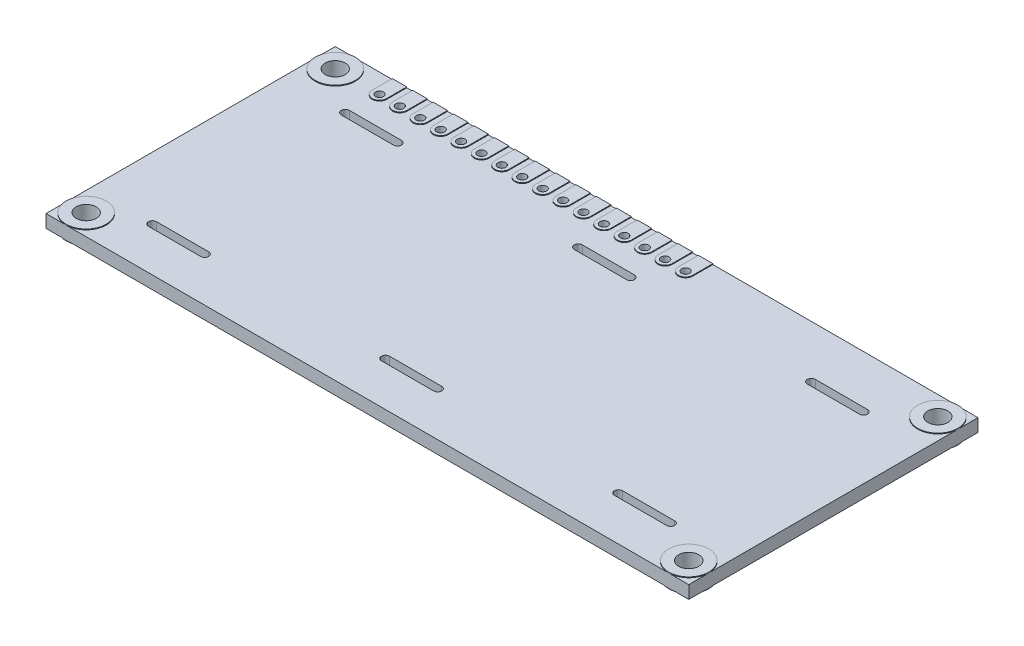
from build123d import *

# Parameters (mm, degrees)
SKETCH1_W           = 80
SKETCH1_H           = 36
SKETCH1_R           = 1.25
SKETCH1_R_2         = 0.5
BOSS_EXTRUDE1_DEPTH = 1.6
BOSS_EXTRUDE2_START = 0.1
SKETCH2_R           = 0.5
BOSS_EXTRUDE2_DEPTH = 0.1
LPATTERN1_COUNT     = 16
LPATTERN1_PITCH     = 2.54
BOSS_EXTRUDE3_START = 0.1
SKETCH3_R           = 2.5
SKETCH3_R_2         = 1.25
BOSS_EXTRUDE3_DEPTH = 0.1
SKETCH4_R           = 2.5
SKETCH4_R_2         = 1.25
BOSS_EXTRUDE4_DEPTH = 0.1


with BuildPart() as part:
    # Sketch1 → Boss-Extrude1 (new body)
    with BuildSketch(Plane(origin=(0, 0, 0), x_dir=(1, 0, 0), z_dir=(0, 1, 0))):
        Rectangle(SKETCH1_W, SKETCH1_H)
        with Locations((-37.5, 15.5)):
            Circle(SKETCH1_R, mode=Mode.SUBTRACT)
        with Locations((-37.5, -15.5)):
            Circle(SKETCH1_R, mode=Mode.SUBTRACT)
        with Locations((37.5, 15.5)):
            Circle(SKETCH1_R, mode=Mode.SUBTRACT)
        with Locations((37.5, -15.5)):
            Circle(SKETCH1_R, mode=Mode.SUBTRACT)
        with Locations((-32, 15.5)):
            Circle(SKETCH1_R_2, mode=Mode.SUBTRACT)
        with Locations((-29.46, 15.5)):
            Circle(SKETCH1_R_2, mode=Mode.SUBTRACT)
        with Locations((-26.92, 15.5)):
            Circle(SKETCH1_R_2, mode=Mode.SUBTRACT)
        with Locations((-24.38, 15.5)):
            Circle(SKETCH1_R_2, mode=Mode.SUBTRACT)
        with Locations((-21.84, 15.5)):
            Circle(SKETCH1_R_2, mode=Mode.SUBTRACT)
        with Locations((-19.3, 15.5)):
            Circle(SKETCH1_R_2, mode=Mode.SUBTRACT)
        with Locations((-16.76, 15.5)):
            Circle(SKETCH1_R_2, mode=Mode.SUBTRACT)
        with Locations((-14.22, 15.5)):
            Circle(SKETCH1_R_2, mode=Mode.SUBTRACT)
        with Locations((-11.68, 15.5)):
            Circle(SKETCH1_R_2, mode=Mode.SUBTRACT)
        with Locations((-9.14, 15.5)):
            Circle(SKETCH1_R_2, mode=Mode.SUBTRACT)
        with Locations((-6.6, 15.5)):
            Circle(SKETCH1_R_2, mode=Mode.SUBTRACT)
        with Locations((-4.06, 15.5)):
            Circle(SKETCH1_R_2, mode=Mode.SUBTRACT)
        with Locations((-1.52, 15.5)):
            Circle(SKETCH1_R_2, mode=Mode.SUBTRACT)
        with Locations((1.02, 15.5)):
            Circle(SKETCH1_R_2, mode=Mode.SUBTRACT)
        with Locations((3.56, 15.5)):
            Circle(SKETCH1_R_2, mode=Mode.SUBTRACT)
        with Locations((6.1, 15.5)):
            Circle(SKETCH1_R_2, mode=Mode.SUBTRACT)
        with BuildLine():
            Line((-3.25, -12), (3.25, -12))
            ThreePointArc((3.25, -12), (3.75, -12.5), (3.25, -13))
            Line((3.25, -13), (-3.25, -13))
            ThreePointArc((-3.25, -13), (-3.75, -12.5), (-3.25, -12))
        make_face(mode=Mode.SUBTRACT)
        with BuildLine():
            Line((25.75, -12), (32.25, -12))
            ThreePointArc((32.25, -12), (32.75, -12.5), (32.25, -13))
            Line((32.25, -13), (25.75, -13))
            ThreePointArc((25.75, -13), (25.25, -12.5), (25.75, -12))
        make_face(mode=Mode.SUBTRACT)
        with BuildLine():
            Line((25.75, 12), (32.25, 12))
            ThreePointArc((32.25, 12), (32.75, 11.5), (32.25, 11))
            Line((32.25, 11), (25.75, 11))
            ThreePointArc((25.75, 11), (25.25, 11.5), (25.75, 12))
        make_face(mode=Mode.SUBTRACT)
        with BuildLine():
            Line((-3.25, 12), (3.25, 12))
            ThreePointArc((3.25, 12), (3.75, 11.5), (3.25, 11))
            Line((3.25, 11), (-3.25, 11))
            ThreePointArc((-3.25, 11), (-3.75, 11.5), (-3.25, 12))
        make_face(mode=Mode.SUBTRACT)
        with BuildLine():
            Line((-32.25, -12), (-25.75, -12))
            ThreePointArc((-25.75, -12), (-25.25, -12.5), (-25.75, -13))
            Line((-25.75, -13), (-32.25, -13))
            ThreePointArc((-32.25, -13), (-32.75, -12.5), (-32.25, -12))
        make_face(mode=Mode.SUBTRACT)
        with BuildLine():
            Line((-32.25, 12), (-25.75, 12))
            ThreePointArc((-25.75, 12), (-25.25, 11.5), (-25.75, 11))
            Line((-25.75, 11), (-32.25, 11))
            ThreePointArc((-32.25, 11), (-32.75, 11.5), (-32.25, 12))
        make_face(mode=Mode.SUBTRACT)
    extrude(amount=-BOSS_EXTRUDE1_DEPTH)

    # Sketch2 → Boss-Extrude2 (add)
    with BuildSketch(Plane(origin=(0, 0, 0), x_dir=(1, 0, 0), z_dir=(0, 1, 0)).offset(BOSS_EXTRUDE2_START)):
        with BuildLine():
            Line((-32.9, 15.5), (-32.9, 18))
            Line((-32.9, 18), (-31.1, 18))
            Line((-31.1, 18), (-31.1, 15.5))
            ThreePointArc((-31.1, 15.5), (-32, 14.6), (-32.9, 15.5))
        make_face()
        with Locations((-32, 15.5)):
            Circle(SKETCH2_R, mode=Mode.SUBTRACT)
    boss_extrude2 = extrude(amount=-BOSS_EXTRUDE2_DEPTH)

    # LPattern1: Boss-Extrude2 ×16
    with Locations(*[(i * LPATTERN1_PITCH, 0, 0) for i in range(1, LPATTERN1_COUNT)]):
        add(boss_extrude2)

    # Sketch3 → Boss-Extrude3 (add)
    # profile 1 of 4: a face of its own
    with BuildSketch(Plane(origin=(0, 0, 0), x_dir=(1, 0, 0), z_dir=(0, 1, 0)).offset(BOSS_EXTRUDE3_START)):
        with Locations((-37.5, 15.5)):
            Circle(SKETCH3_R)
        with Locations((-37.5, 15.5)):
            Circle(SKETCH3_R_2, mode=Mode.SUBTRACT)
    # profile 2 of 4: a face of its own
    with BuildSketch(Plane(origin=(0, 0, 0), x_dir=(1, 0, 0), z_dir=(0, 1, 0)).offset(BOSS_EXTRUDE3_START)):
        with Locations((-37.5, -15.5)):
            Circle(SKETCH3_R)
        with Locations((-37.5, -15.5)):
            Circle(SKETCH3_R_2, mode=Mode.SUBTRACT)
    # profile 3 of 4: a face of its own
    with BuildSketch(Plane(origin=(0, 0, 0), x_dir=(1, 0, 0), z_dir=(0, 1, 0)).offset(BOSS_EXTRUDE3_START)):
        with Locations((37.5, -15.5)):
            Circle(SKETCH3_R)
        with Locations((37.5, -15.5)):
            Circle(SKETCH3_R_2, mode=Mode.SUBTRACT)
    # profile 4 of 4: a face of its own
    with BuildSketch(Plane(origin=(0, 0, 0), x_dir=(1, 0, 0), z_dir=(0, 1, 0)).offset(BOSS_EXTRUDE3_START)):
        with Locations((37.5, 15.5)):
            Circle(SKETCH3_R)
        with Locations((37.5, 15.5)):
            Circle(SKETCH3_R_2, mode=Mode.SUBTRACT)
    extrude(amount=-BOSS_EXTRUDE3_DEPTH)

    # Sketch4 → Boss-Extrude4 (add)
    # profile 1 of 4: a face of its own
    with BuildSketch(Plane.XZ.offset(1.6)):
        with Locations((37.5, -15.5)):
            Circle(SKETCH4_R)
        with Locations((37.5, -15.5)):
            Circle(SKETCH4_R_2, mode=Mode.SUBTRACT)
    # profile 2 of 4: a face of its own
    with BuildSketch(Plane.XZ.offset(1.6)):
        with Locations((37.5, 15.5)):
            Circle(SKETCH4_R)
        with Locations((37.5, 15.5)):
            Circle(SKETCH4_R_2, mode=Mode.SUBTRACT)
    # profile 3 of 4: a face of its own
    with BuildSketch(Plane.XZ.offset(1.6)):
        with Locations((-37.5, 15.5)):
            Circle(SKETCH4_R)
        with Locations((-37.5, 15.5)):
            Circle(SKETCH4_R_2, mode=Mode.SUBTRACT)
    # profile 4 of 4: a face of its own
    with BuildSketch(Plane.XZ.offset(1.6)):
        with Locations((-37.5, -15.5)):
            Circle(SKETCH4_R)
        with Locations((-37.5, -15.5)):
            Circle(SKETCH4_R_2, mode=Mode.SUBTRACT)
    extrude(amount=BOSS_EXTRUDE4_DEPTH)


solid = part.part
